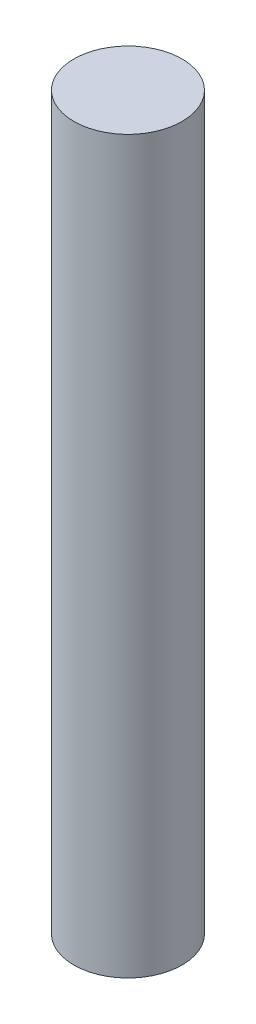
from build123d import *

# Parameters (mm, degrees)
SKETCH_1_R      = 1
EXTRUDE_1_DEPTH = 13.5


with BuildPart() as part:
    # 草图1 → 凸台-拉伸1 (new body)
    with BuildSketch(Plane(origin=(0, 0, 0), x_dir=(1, 0, 0), z_dir=(0, 1, 0))):
        Circle(SKETCH_1_R)
    extrude(amount=EXTRUDE_1_DEPTH)


solid = part.part
